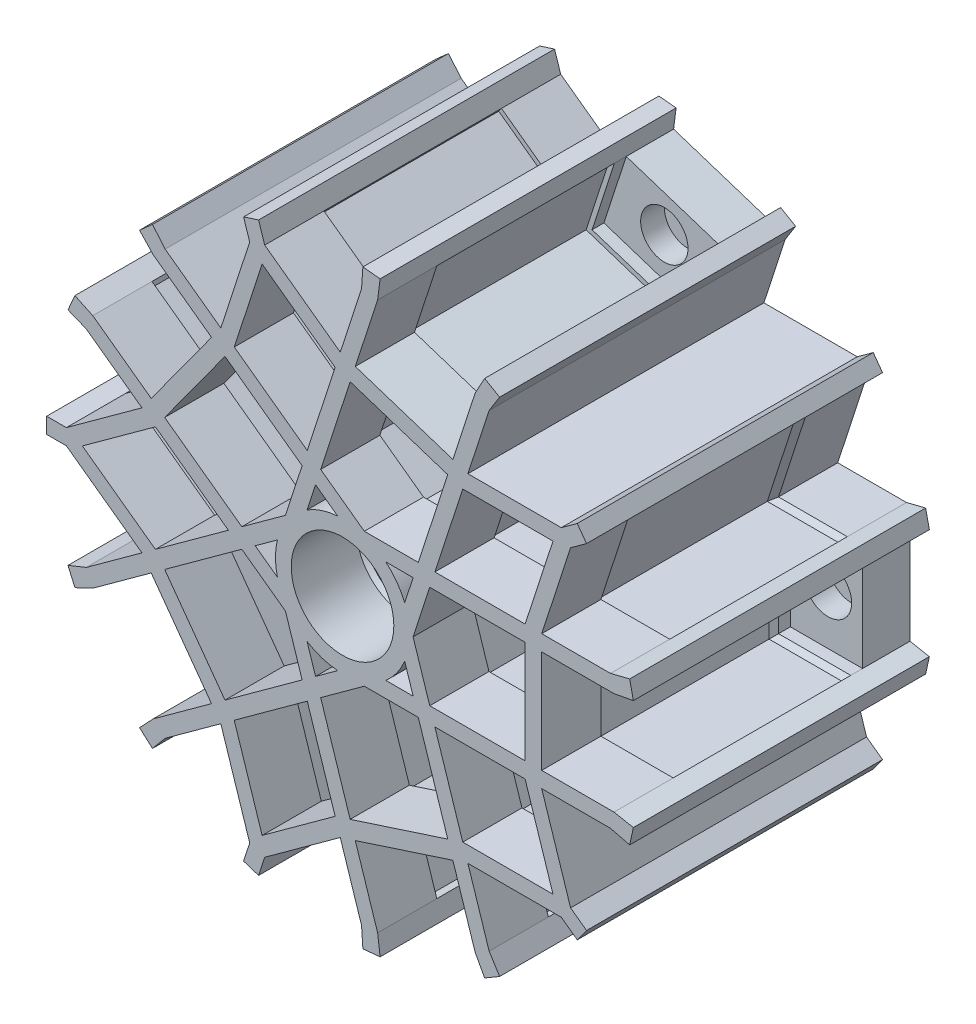
from build123d import *

# Parameters (mm, degrees)
SKETCH1_R           = 17
SKETCH1_R_2         = 13
BOSS_EXTRUDE1_DEPTH = 37.5
BOSS_EXTRUDE2_DEPTH = 37.5
CIRPATTERN1_COUNT   = 5
BOSS_EXTRUDE3_DEPTH = 37.5
CIRPATTERN2_COUNT   = 5
SKETCH4_R           = 13
SKETCH4_R_2         = 5.5
BOSS_EXTRUDE4_DEPTH = 20
CHAMFER1_SIZE       = 1
CUT_EXTRUDE2_DEPTH  = 22.5
CHAMFER3_SIZE       = 1.2
CIRPATTERN3_COUNT   = 5
SKETCH10_W          = 18.31261121
SKETCH10_H          = 26
SKETCH10_R          = 2.5
BOSS_EXTRUDE5_DEPTH = 12
SKETCH11_R          = 6
CUT_EXTRUDE3_DEPTH  = 6
CIRPATTERN4_COUNT   = 5
SKETCH12_R          = 2.5
BOSS_EXTRUDE6_DEPTH = 10
CIRPATTERN5_COUNT   = 5


with BuildPart() as part:
    # Sketch1 → Boss-Extrude1 (new, symmetric)
    with BuildSketch(Plane.XY):
        Circle(SKETCH1_R)
        Circle(SKETCH1_R_2, mode=Mode.SUBTRACT)
    extrude(amount=BOSS_EXTRUDE1_DEPTH, both=True)

    # Sketch2 → Boss-Extrude2 (add, symmetric)
    with BuildSketch(Plane.XY):
        Polygon((0, 17), (0, 13), (68.782265156, 13), (73.695284096, 13.928571429), (72.754654806, 18.214285714), (67.904344485, 17), align=None)
        Polygon((68.782265156, -13), (73.695284096, -13.928571429), (72.754654806, -18.214285714), (67.904344485, -17), (0, -17), (0, -13), align=None)
    boss_extrude2 = extrude(amount=BOSS_EXTRUDE2_DEPTH, both=True)

    # CirPattern1: Boss-Extrude2 ×5 about axis
    cirpattern1_axis = Axis((0, 0, 0), (0, 0, 1))
    for i in range(1, CIRPATTERN1_COUNT):
        add(boss_extrude2.rotate(cirpattern1_axis, i * 360 / CIRPATTERN1_COUNT))

    # Sketch3 → Boss-Extrude3 (add, symmetric)
    with BuildSketch(Plane.XY):
        Polygon((55.432499611, 42.746204356), (59.47912645, 45.68625085), (61.830267459, 42.450182872), (57.78364062, 39.510136379), (50.469653946, 17), (50.469653946, -13), (46.263805049, -13), (46.263805049, 17), (53.329575163, 38.746204356), (30.464262762, 38.746204356), (31.763941547, 42.746204356), align=None)
    boss_extrude3 = extrude(amount=BOSS_EXTRUDE3_DEPTH, both=True)

    # CirPattern2: Boss-Extrude3 ×5 about axis
    cirpattern2_axis = Axis((0, 0, 0), (0, 0, 1))
    for i in range(1, CIRPATTERN2_COUNT):
        add(boss_extrude3.rotate(cirpattern2_axis, i * 360 / CIRPATTERN2_COUNT))

    # Sketch4 → Boss-Extrude4 (add, symmetric)
    with BuildSketch(Plane.XY):
        Circle(SKETCH4_R)
        Circle(SKETCH4_R_2, mode=Mode.SUBTRACT)
    extrude(amount=BOSS_EXTRUDE4_DEPTH, both=True)

    # Chamfer1
    chamfer1_edges = [part.edges().sort_by_distance(p)[0] for p in [
        (-13, 0, 20),
        (-13, 0, -20),
    ]]
    chamfer(chamfer1_edges, length=CHAMFER1_SIZE)

    # Sketch9 → Cut-Extrude2 (cut, symmetric)
    with BuildSketch(Plane.XY):
        with BuildLine():
            Line((6.92820323, 14.2), (19.544623271, 14.2))
            Line((19.544623271, 14.2), (15.64593507, 2.201071508))
            ThreePointArc((15.64593507, 2.201071508), (12.782468511, 9.287006986), (6.92820323, 14.2))
        make_face()
        Polygon((54.981233467, 39.946204356), (47.135656083, 15.8), (21.746834343, 15.8), (29.592411728, 39.946204356), align=None)
        Polygon((21.226962829, -14.2), (16.613103143, 0), (21.226962829, 14.2), (47.463805049, 14.2), (47.463805049, -14.2), align=None)
        Polygon((67.498447825, 15.8), (48.817995641, 15.8), (56.642372801, 39.880956772), (57.78364062, 39.510136379), (67.904344485, 17), align=None)
        Polygon((68.025868324, -14.2), (49.269653946, -14.2), (49.269653946, 14.2), (68.025868324, 14.2), (68.782265156, 13), (68.782265156, -13), align=None)
    cut_extrude2 = extrude(amount=CUT_EXTRUDE2_DEPTH, both=True, mode=Mode.SUBTRACT)

    # Chamfer3
    chamfer3_edges = [part.edges().sort_by_distance(p)[0] for p in [
        (51.058444775, 27.873102178, -22.5),
        (42.286822598, 39.946204356, -22.5),
        (25.669623036, 27.873102178, -22.5),
        (34.441245213, 15.8, -22.5),
        (18.920032986, 7.1, -22.5),
        (18.920032986, -7.1, -22.5),
        (34.345383939, 14.2, -22.5),
        (47.463805049, 0, -22.5),
        (34.345383939, -14.2, -22.5),
        (58.158221733, 15.8, -22.5),
        (52.730184221, 27.840478386, -22.5),
        (58.647761135, 14.2, -22.5),
        (49.269653946, 0, -22.5),
        (58.647761135, -14.2, -22.5),
    ]]
    chamfer(chamfer3_edges, length=CHAMFER3_SIZE - 0.0001)  # a hair under: the kernel refuses the full size

    # CirPattern3: Cut-Extrude2 ×5 about axis
    cirpattern3_axis = Axis((0, 0, 0), (0, 0, 1))
    for i in range(1, CIRPATTERN3_COUNT):
        add(cut_extrude2.rotate(cirpattern3_axis, i * 360 / CIRPATTERN3_COUNT), mode=Mode.SUBTRACT)

    # Sketch10 → Boss-Extrude5 (add)
    with BuildSketch(Plane(origin=(0, 0, -37.5), x_dir=(-1, 0, 0), z_dir=(0, 0, -1))):
        with Locations((-59.625959551, 0)):
            Rectangle(SKETCH10_W, SKETCH10_H)
        with Locations((-60, 0)):
            Circle(SKETCH10_R, mode=Mode.SUBTRACT)
    boss_extrude5 = extrude(amount=-BOSS_EXTRUDE5_DEPTH)

    # Sketch11 → Cut-Extrude3 (cut)
    with BuildSketch(Plane.XY.offset(-25.5)):
        with Locations((60, 0)):
            Circle(SKETCH11_R)
    cut_extrude3 = extrude(amount=-CUT_EXTRUDE3_DEPTH, mode=Mode.SUBTRACT)

    # CirPattern4: Boss-Extrude5, Cut-Extrude3 ×5 about axis
    cirpattern4_axis = Axis((0, 0, 0), (0, 0, 1))
    add([boss_extrude5.rotate(cirpattern4_axis, i * 360 / CIRPATTERN4_COUNT) for i in range(1, CIRPATTERN4_COUNT)])
    add([cut_extrude3.rotate(cirpattern4_axis, i * 360 / CIRPATTERN4_COUNT) for i in range(1, CIRPATTERN4_COUNT)], mode=Mode.SUBTRACT)

    # Sketch12 → Boss-Extrude6 (add)
    with BuildSketch(Plane(origin=(0, 0, -37.5), x_dir=(-1, 0, 0), z_dir=(0, 0, -1))):
        Polygon((-22.098813863, -13), (-17.874857812, 0), (-22.098813863, 13), (-27.901186137, 13), (-32.125142188, 0), (-27.901186137, -13), align=None)
        with Locations((-25, 0)):
            Circle(SKETCH12_R, mode=Mode.SUBTRACT)
    boss_extrude6 = extrude(amount=-BOSS_EXTRUDE6_DEPTH)

    # CirPattern5: Boss-Extrude6 ×5 about axis
    cirpattern5_axis = Axis((0, 0, 0), (0, 0, 1))
    for i in range(1, CIRPATTERN5_COUNT):
        add(boss_extrude6.rotate(cirpattern5_axis, i * 360 / CIRPATTERN5_COUNT))


solid = part.part
